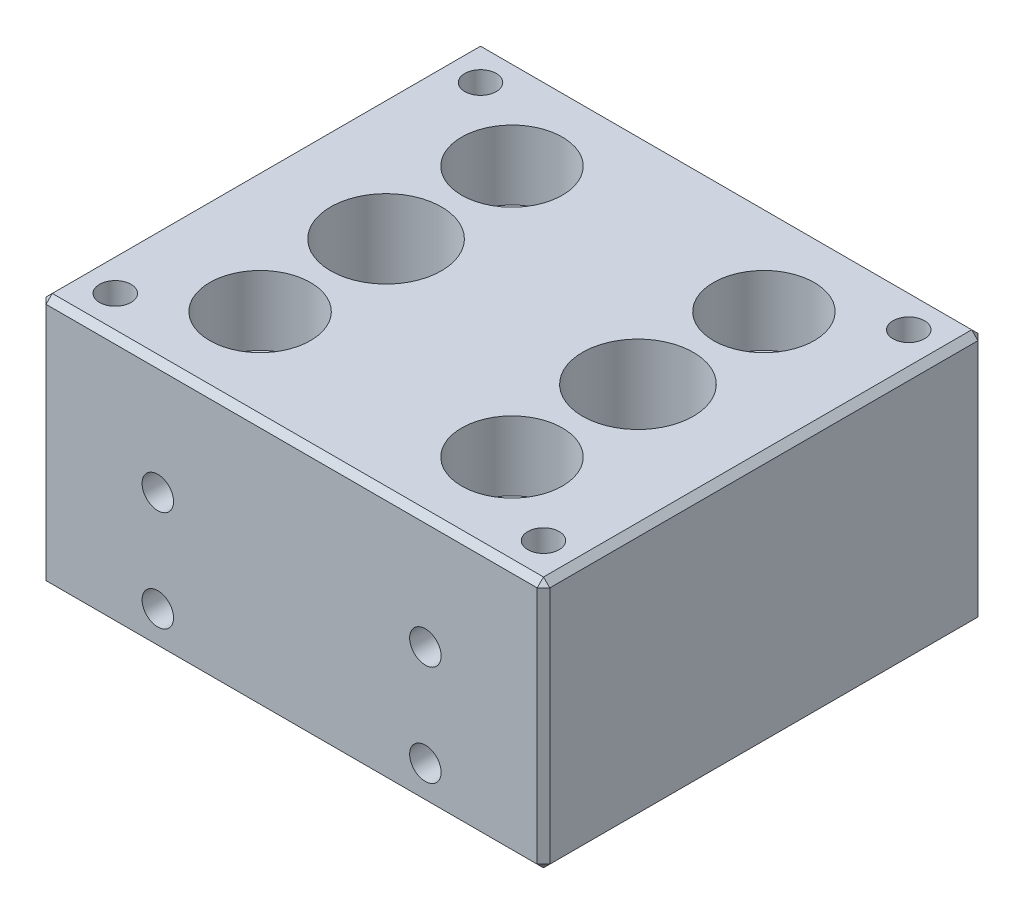
from build123d import *

# Parameters (mm, degrees)
SKETCH1_W                       = 40
SKETCH1_H                       = 35
BOSS_EXTRUDE1_DEPTH             = 20
TAP_DRILL_FOR_M3X0_5_TAP1_D     = 2.5
TAP_DRILL_FOR_M3X0_5_TAP1_DEPTH = 4
F_8_4_8_4_DIAMETER_HOLE2_D      = 8.4
F_8_4_8_4_DIAMETER_HOLE2_DEPTH  = 15
F_8_4_8_4_DIAMETER_HOLE2_TIP    = 2.5236146
F_8_4_8_4_DIAMETER_HOLE1_D      = 8.4
F_8_4_8_4_DIAMETER_HOLE1_DEPTH  = 35
F_8_4_8_4_DIAMETER_HOLE1_TIP    = 2.5236146
F_7_0_7_DIAMETER_HOLE1_D        = 7
F_7_0_7_DIAMETER_HOLE1_DEPTH    = 15
F_7_0_7_DIAMETER_HOLE1_TIP      = 2.103012167
F_8_0_8_DIAMETER_HOLE1_D        = 8
F_8_0_8_DIAMETER_HOLE1_DEPTH    = 5.5
TAP_DRILL_FOR_M3X0_5_TAP2_D     = 2.5
TAP_DRILL_FOR_M3X0_5_TAP2_DEPTH = 5.5
CHAMFER1_SIZE                   = 0.5
G1_8_TAPPED_HOLE1_D             = 8.8
G1_8_TAPPED_HOLE1_DEPTH         = 10


with BuildPart() as part:
    # Sketch1 → Boss-Extrude1 (new body)
    with BuildSketch(Plane(origin=(0, 0, 0), x_dir=(1, 0, 0), z_dir=(0, 1, 0))):
        Rectangle(SKETCH1_W, SKETCH1_H)
    extrude(amount=BOSS_EXTRUDE1_DEPTH)

    # Tap Drill for M3x0.5 Tap1
    with Locations(Plane(origin=(0, 20, 0), x_dir=(1, 0, 0), z_dir=(0, 1, 0))):
        with Locations((-17, 14.5), (17, 14.5), (17, -14.5), (-17, -14.5)):
            Hole(TAP_DRILL_FOR_M3X0_5_TAP1_D / 2, depth=TAP_DRILL_FOR_M3X0_5_TAP1_DEPTH)

    # Ø8.4 (8.4) Diameter Hole2
    with Locations(Plane(origin=(0, 20, 0), x_dir=(1, 0, 0), z_dir=(0, 1, 0))):
        with Locations((-10, 0), (10, 0)):
            Hole(F_8_4_8_4_DIAMETER_HOLE2_D / 2, depth=F_8_4_8_4_DIAMETER_HOLE2_DEPTH)
            with Locations((0, 0, -(F_8_4_8_4_DIAMETER_HOLE2_DEPTH + F_8_4_8_4_DIAMETER_HOLE2_TIP / 2))):  # 118° drill point
                Cone(0, F_8_4_8_4_DIAMETER_HOLE2_D / 2, F_8_4_8_4_DIAMETER_HOLE2_TIP, mode=Mode.SUBTRACT)

    # Ø8.4 (8.4) Diameter Hole1
    with Locations(Plane.ZY.offset(20)):
        with Locations((0, 5)):
            Hole(F_8_4_8_4_DIAMETER_HOLE1_D / 2, depth=F_8_4_8_4_DIAMETER_HOLE1_DEPTH)
            with Locations((0, 0, -(F_8_4_8_4_DIAMETER_HOLE1_DEPTH + F_8_4_8_4_DIAMETER_HOLE1_TIP / 2))):  # 118° drill point
                Cone(0, F_8_4_8_4_DIAMETER_HOLE1_D / 2, F_8_4_8_4_DIAMETER_HOLE1_TIP, mode=Mode.SUBTRACT)

    # Ø7.0 (7) Diameter Hole1
    with Locations(Plane(origin=(0, 0, 0), x_dir=(-1, 0, 0), z_dir=(0, -1, 0))):
        with Locations((10, -10), (-10, -10), (-10, 10), (10, 10)):
            Hole(F_7_0_7_DIAMETER_HOLE1_D / 2, depth=F_7_0_7_DIAMETER_HOLE1_DEPTH)
            with Locations((0, 0, -(F_7_0_7_DIAMETER_HOLE1_DEPTH + F_7_0_7_DIAMETER_HOLE1_TIP / 2))):  # 118° drill point
                Cone(0, F_7_0_7_DIAMETER_HOLE1_D / 2, F_7_0_7_DIAMETER_HOLE1_TIP, mode=Mode.SUBTRACT)

    # Ø8.0 (8) Diameter Hole1
    with Locations(Plane(origin=(0, 20, 0), x_dir=(1, 0, 0), z_dir=(0, 1, 0))):
        with Locations((-10, 10), (10, 10), (10, -10), (-10, -10)):
            Hole(F_8_0_8_DIAMETER_HOLE1_D / 2, depth=F_8_0_8_DIAMETER_HOLE1_DEPTH)

    # Tap Drill for M3x0.5 Tap2
    with Locations(Plane.XY.offset(17.5)):
        with Locations((-10.622143035, 11), (-10.622143035, 3), (10.622143035, 3), (10.622143035, 11)):
            tap_drill_for_m3x0_5_tap2 = Hole(TAP_DRILL_FOR_M3X0_5_TAP2_D / 2, depth=TAP_DRILL_FOR_M3X0_5_TAP2_DEPTH)

    # Mirror1: Tap Drill for M3x0.5 Tap2 across plane
    add(tap_drill_for_m3x0_5_tap2.mirror(Plane.XY), mode=Mode.SUBTRACT)

    # Chamfer1
    chamfer1_edges = [part.edges().sort_by_distance(p)[0] for p in [
        (0, 20, -17.5),
        (0, 0, -17.5),
        (20, 0, 0),
        (20, 10, -17.5),
        (20, 20, 0),
        (20, 10, 17.5),
        (-20, 0, 0),
        (-20, 10, -17.5),
        (0, 0, 17.5),
        (-20, 20, 0),
        (0, 20, 17.5),
        (-20, 10, 17.5),
    ]]
    chamfer(chamfer1_edges, length=CHAMFER1_SIZE)

    # G1/8 Tapped Hole1
    with Locations(Plane(origin=(0, 20, 0), x_dir=(1, 0, 0), z_dir=(0, 1, 0))):
        with Locations((-10, 0), (10, 0)):
            Hole(G1_8_TAPPED_HOLE1_D / 2, depth=G1_8_TAPPED_HOLE1_DEPTH)


solid = part.part
